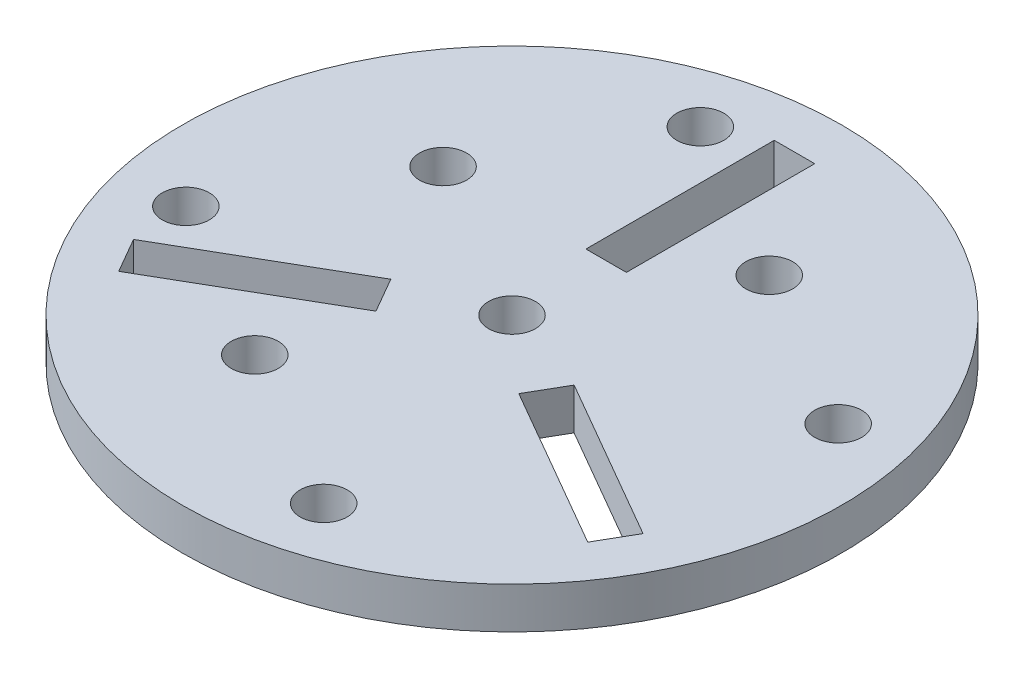
from build123d import *

# Parameters (mm, degrees)
SKETCH2_R               = 44.45
SKETCH2_W               = 5.461
SKETCH2_H               = 25.4
BOSS_EXTRUDE1_DEPTH     = 5.588
SKETCH3_R               = 3.175
CUT_EXTRUDE1_DEPTH      = 64.109672349
FILL_PATTERN1_OUTLINE_R = 3.175
FILL_PATTERN1_DEPTH     = 5.588


# Read off the part's stored shape, not the designer's step: Fill Pattern1
with BuildPart() as part:
    # Sketch2 → Boss-Extrude1 (new body)
    with BuildSketch(Plane(origin=(0, 0, 0), x_dir=(1, 0, 0), z_dir=(0, 1, 0))):
        with Locations(Location((0, 0, 0), (0, 0, 270))):
            Circle(SKETCH2_R)
        with Locations((0, 25.4)):
            Rectangle(SKETCH2_W, SKETCH2_H, mode=Mode.SUBTRACT)
        Polygon((34.360817884, -16.685317635), (31.630317884, -21.414682365), (9.633272628, -8.714682365), (12.363772628, -3.985317635), align=None, mode=Mode.SUBTRACT)
        Polygon((-31.630317884, -21.414682365), (-34.360817884, -16.685317635), (-12.363772628, -3.985317635), (-9.633272628, -8.714682365), align=None, mode=Mode.SUBTRACT)
    extrude(amount=BOSS_EXTRUDE1_DEPTH)

    # Sketch3 → Cut-Extrude1 (cut, through all)
    with BuildSketch(Plane(origin=(0, 5.588, 0), x_dir=(1, 0, 0), z_dir=(0, 1, 0))):
        with Locations(Location((0, 0, 0), (0, 0, 270))):
            Circle(SKETCH3_R)
    extrude(amount=-CUT_EXTRUDE1_DEPTH, mode=Mode.SUBTRACT)

    # Fill Pattern1 outline → Fill Pattern1 (cut)
    with BuildSketch(Plane(origin=(0, 0, 0), x_dir=(1, 0, 0), z_dir=(0, 1, 0))):
        with Locations((34.697045256, 9.297045256)):
            Circle(FILL_PATTERN1_OUTLINE_R)
        with Locations((9.297045256, -34.697045256)):
            Circle(FILL_PATTERN1_OUTLINE_R)
        with Locations((-12.7, -21.997045256)):
            Circle(FILL_PATTERN1_OUTLINE_R)
        with Locations((-34.697045256, -9.297045256)):
            Circle(FILL_PATTERN1_OUTLINE_R)
        with Locations((-21.997045256, 12.7)):
            Circle(FILL_PATTERN1_OUTLINE_R)
        with Locations((-9.297045256, 34.697045256)):
            Circle(FILL_PATTERN1_OUTLINE_R)
        with Locations((12.7, 21.997045256)):
            Circle(FILL_PATTERN1_OUTLINE_R)
    extrude(amount=FILL_PATTERN1_DEPTH, mode=Mode.SUBTRACT)


solid = part.part
